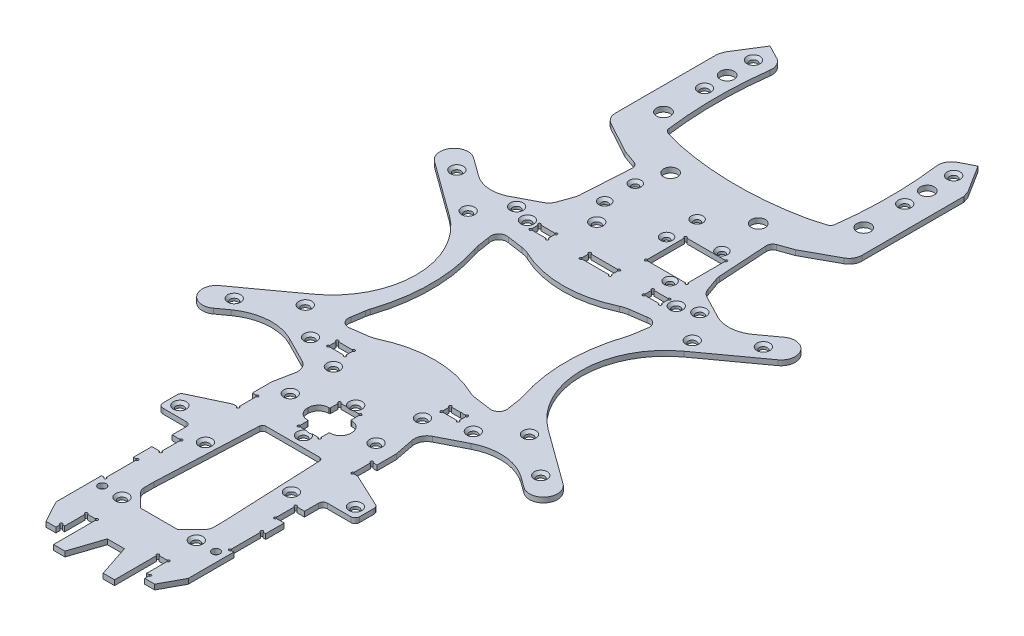
from build123d import *

# Parameters (mm, degrees)
SKETCH_1_R               = 1.075
SKETCH_1_R_2             = 1.55
SKETCH_1_R_3             = 3.15
SKETCH_1_R_4             = 1.3
SKETCH_1_R_5             = 2.75
SKETCH_1_R_6             = 3.150000003
SKETCH_1_W               = 8.2
SKETCH_1_H               = 15.5
EXTRUDE_1_DEPTH          = 2
CUT_EXTRUDE_8318_REACH   = 179.316
CUT_EXTRUDE_2_DEPTH      = 178.315547956
CUT_EXTRUDE_2_DEPTH_BACK = 178.315547956
FILLET_1_R               = 5
CUT_EXTRUDE_10782_REACH  = 179.316
SKETCH_7_W               = 6.5
SKETCH_7_H               = 3.5
SKETCH_7_W_2             = 11.5
SKETCH_8_W               = 7.75
SKETCH_8_H               = 15.5
SKETCH_8_R               = 1.55
PCB_DEPTH                = 178.315547956
FILLET_2_R               = 1.75
SKETCH_12_R              = 1.55
CUT_EXTRUDE_12404_DEPTH  = 178.315547956
CHAMFER_13500_SIZE       = 1
CUT_EXTRUDE_14527_DEPTH  = 178.315547956
SKETCH_14808_R           = 0.5
CUT_EXTRUDE_16013_DEPTH  = 178.315547956


with BuildPart() as part:
    # 草图1 → 凸台-拉伸1 (new body)
    with BuildSketch(Plane(origin=(0, 0, 0), x_dir=(1, 0, 0), z_dir=(0, 1, 0))):
        with BuildLine():
            Line((30.471931762, 81.490896857), (48.416521639, 91.317818223))
            Line((48.416521639, 91.317818223), (48.416521639, 134.322222668))
            Line((48.416521639, 134.322222668), (47.651247851, 136.689513364))
            Line((47.651247851, 136.689513364), (40.869501648, 147.464808499))
            Line((40.869501648, 147.464808499), (35.510663468, 144.702808272))
            ThreePointArc((35.510663468, 144.702808272), (33.242094057, 142.452145099), (32.67537009, 139.307194251))
            ThreePointArc((32.67537009, 139.307194251), (33.937004878, 119.372552101), (32.641885169, 99.440057402))
            ThreePointArc((32.641885169, 99.440057402), (32.172065597, 98.389885069), (31.201404983, 97.7723008))
            Line((31.201404983, 97.7723008), (25.278020284, 96.101602551))
            ThreePointArc((25.278020284, 96.101602551), (0, 93.449866343), (-25.278020284, 96.101602551))
            Line((-25.278020284, 96.101602551), (-31.201404983, 97.7723008))
            ThreePointArc((-31.201404983, 97.7723008), (-32.172065597, 98.389885069), (-32.641885169, 99.440057402))
            ThreePointArc((-32.641885169, 99.440057402), (-33.937004878, 119.372552101), (-32.67537009, 139.307194251))
            ThreePointArc((-32.67537009, 139.307194251), (-33.242094057, 142.452145099), (-35.510663468, 144.702808272))
            Line((-35.510663468, 144.702808272), (-40.869501648, 147.464808499))
            Line((-40.869501648, 147.464808499), (-47.651247851, 136.689513364))
            Line((-47.651247851, 136.689513364), (-48.416521639, 134.322222668))
            Line((-48.416521639, 134.322222668), (-48.416521639, 91.317818223))
            Line((-48.416521639, 91.317818223), (-30.471931762, 81.490896857))
            Line((-30.471931762, 81.490896857), (-34.379381927, 54.281455672))
            ThreePointArc((-34.379381927, 54.281455672), (-41.833088467, 44.612792097), (-53.961797186, 46.00391442))
            Line((-53.961797186, 46.00391442), (-61.036827427, 51.144224776))
            ThreePointArc((-61.036827427, 51.144224776), (-68.719239783, 49.927450195), (-67.502465202, 42.245037838))
            Line((-67.502465202, 42.245037838), (-46.1030207, 26.697431331))
            ThreePointArc((-46.1030207, 26.697431331), (-32.5, 0), (-46.1030207, -26.697431331))
            Line((-46.1030207, -26.697431331), (-67.502465202, -42.245037838))
            ThreePointArc((-67.502465202, -42.245037838), (-68.719239783, -49.927450195), (-61.036827427, -51.144224776))
            Line((-61.036827427, -51.144224776), (-57.019972942, -48.225809165))
            ThreePointArc((-57.019972942, -48.225809165), (-35.683007368, -46.546553555), (-24.5, -64.795562996))
            Line((-24.5, -64.795562996), (-24.5, -72.371672247))
            Line((-24.5, -72.371672247), (-22.5, -72.371672247))
            Line((-22.5, -72.371672247), (-22.5, -79.947781498))
            Line((-22.5, -79.947781498), (-24.5, -79.947781498))
            Line((-24.5, -79.947781498), (-38.680376069, -86.6))
            Line((-38.680376069, -86.6), (-38.680376069, -95.1))
            Line((-38.680376069, -95.1), (-26.001126091, -95.1))
            Line((-26.001126091, -95.1), (-26.001126091, -102.35))
            Line((-26.001126091, -102.35), (-22.5, -102.35))
            Line((-22.5, -102.35), (-22.5, -110.35))
            Line((-22.5, -110.35), (-26.001126091, -110.35))
            Line((-26.001126091, -110.35), (-26.001126091, -117.6))
            Line((-26.001126091, -117.6), (-24.501126091, -117.6))
            Line((-24.501126091, -117.6), (-24.501126091, -130.1))
            Line((-24.501126091, -130.1), (-26.001126091, -130.1))
            Line((-26.001126091, -130.1), (-26.001126091, -148.0463267))
            Line((-26.001126091, -148.0463267), (-21.353443149, -156.6))
            Line((-21.353443149, -156.6), (-17.45, -156.6))
            Line((-17.45, -156.6), (-17.45, -154.5))
            Line((-17.45, -154.5), (-16.1, -154.5))
            Line((-16.1, -154.5), (-16.1, -146))
            Line((-16.1, -146), (-12, -146))
            Line((-12, -146), (-12, -163))
            Line((-12, -163), (-7.5, -163))
            Line((-7.5, -163), (-3.358391833, -150.5))
            Line((-3.358391833, -150.5), (3.358391833, -150.5))
            Line((3.358391833, -150.5), (7.5, -163))
            Line((7.5, -163), (12, -163))
            Line((12, -163), (12, -146))
            Line((12, -146), (16.1, -146))
            Line((16.1, -146), (16.1, -154.5))
            Line((16.1, -154.5), (17.45, -154.5))
            Line((17.45, -154.5), (17.45, -156.6))
            Line((17.45, -156.6), (21.353443149, -156.6))
            Line((21.353443149, -156.6), (26.001126091, -148.0463267))
            Line((26.001126091, -148.0463267), (26.001126091, -130.1))
            Line((26.001126091, -130.1), (24.501126091, -130.1))
            Line((24.501126091, -130.1), (24.501126091, -117.6))
            Line((24.501126091, -117.6), (26.001126091, -117.6))
            Line((26.001126091, -117.6), (26.001126091, -110.35))
            Line((26.001126091, -110.35), (22.5, -110.35))
            Line((22.5, -110.35), (22.5, -102.35))
            Line((22.5, -102.35), (26.001126091, -102.35))
            Line((26.001126091, -102.35), (26.001126091, -95.1))
            Line((26.001126091, -95.1), (38.680376069, -95.1))
            Line((38.680376069, -95.1), (38.680376069, -86.6))
            Line((38.680376069, -86.6), (24.5, -79.947781498))
            Line((24.5, -79.947781498), (22.5, -79.947781498))
            Line((22.5, -79.947781498), (22.5, -72.371672247))
            Line((22.5, -72.371672247), (24.5, -72.371672247))
            Line((24.5, -72.371672247), (24.5, -64.795562996))
            ThreePointArc((24.5, -64.795562996), (35.683007368, -46.546553555), (57.019972942, -48.225809165))
            Line((57.019972942, -48.225809165), (61.036827427, -51.144224776))
            ThreePointArc((61.036827427, -51.144224776), (68.719239784, -49.927450195), (67.502465202, -42.245037838))
            Line((67.502465202, -42.245037838), (46.1030207, -26.697431331))
            ThreePointArc((46.1030207, -26.697431331), (32.5, 0), (46.1030207, 26.697431331))
            Line((46.1030207, 26.697431331), (67.502465202, 42.245037838))
            ThreePointArc((67.502465202, 42.245037838), (68.719239784, 49.927450195), (61.036827427, 51.144224776))
            Line((61.036827427, 51.144224776), (53.961797187, 46.00391442))
            ThreePointArc((53.961797187, 46.00391442), (41.833088467, 44.612792097), (34.379381927, 54.281455672))
            Line((34.379381927, 54.281455672), (30.471931762, 81.490896857))
        make_face()
        with Locations(Location((10, 10, 0), (0, 0, 270))):
            Circle(SKETCH_1_R, mode=Mode.SUBTRACT)
        with Locations(Location((12.75, 12.75, 0), (0, 0, 270))):
            Circle(SKETCH_1_R, mode=Mode.SUBTRACT)
        with Locations(Location((15.25, 15.25, 0), (0, 0, 270))):
            Circle(SKETCH_1_R_2, mode=Mode.SUBTRACT)
        with Locations(Location((-15.25, 15.25, 0), (0, 0, 90))):
            Circle(SKETCH_1_R_2, mode=Mode.SUBTRACT)
        with Locations(Location((-12.75, 12.75, 0), (0, 0, 90))):
            Circle(SKETCH_1_R, mode=Mode.SUBTRACT)
        with Locations(Location((-10, 10, 0), (0, 0, 90))):
            Circle(SKETCH_1_R, mode=Mode.SUBTRACT)
        with Locations(Location((-10, -10, 0), (0, 0, 270))):
            Circle(SKETCH_1_R, mode=Mode.SUBTRACT)
        with Locations(Location((-12.75, -12.75, 0), (0, 0, 270))):
            Circle(SKETCH_1_R, mode=Mode.SUBTRACT)
        with Locations(Location((-15.25, -15.25, 0), (0, 0, 270))):
            Circle(SKETCH_1_R_2, mode=Mode.SUBTRACT)
        with Locations(Location((15.25, -15.25, 0), (0, 0, 90))):
            Circle(SKETCH_1_R_2, mode=Mode.SUBTRACT)
        with Locations(Location((12.75, -12.75, 0), (0, 0, 90))):
            Circle(SKETCH_1_R, mode=Mode.SUBTRACT)
        with Locations(Location((10, -10, 0), (0, 0, 90))):
            Circle(SKETCH_1_R, mode=Mode.SUBTRACT)
        with Locations(Location((28, -28, 0), (0, 0, 90))):
            Circle(SKETCH_1_R_3, mode=Mode.SUBTRACT)
        with Locations(Location((-28, -28, 0), (0, 0, 270))):
            Circle(SKETCH_1_R_3, mode=Mode.SUBTRACT)
        with Locations(Location((19.5, 68.199999999, 0), (0, 0, 90))):
            Circle(SKETCH_1_R_4, mode=Mode.SUBTRACT)
        with Locations(Location((19.5, 47.800000001, 0), (0, 0, 90))):
            Circle(SKETCH_1_R_4, mode=Mode.SUBTRACT)
        with Locations(Location((17.23796389, 84.763336754, 0), (0, 0, 270))):
            Circle(SKETCH_1_R_5, mode=Mode.SUBTRACT)
        with Locations(Location((-17.23796389, 84.763336754, 0), (0, 0, 90))):
            Circle(SKETCH_1_R_5, mode=Mode.SUBTRACT)
        with Locations(Location((-39.335, 104.082300402, 0), (0, 0, 90))):
            Circle(SKETCH_1_R_5, mode=Mode.SUBTRACT)
        with Locations(Location((-39.335, 129.082300402, 0), (0, 0, 90))):
            Circle(SKETCH_1_R_5, mode=Mode.SUBTRACT)
        with Locations(Location((-28, 28, 0), (0, 0, 90))):
            Circle(SKETCH_1_R_6, mode=Mode.SUBTRACT)
        with Locations(Location((28, 28, 0), (0, 0, 270))):
            Circle(SKETCH_1_R_6, mode=Mode.SUBTRACT)
        with Locations(Location((44.044221455, -32, 0), (0, 0, 270))):
            Circle(SKETCH_1_R_2, mode=Mode.SUBTRACT)
        with Locations(Location((60.224561343, -43.755705046, 0), (0, 0, 270))):
            Circle(SKETCH_1_R_2, mode=Mode.SUBTRACT)
        with Locations(Location((-60.224561343, -43.755705046, 0), (0, 0, 90))):
            Circle(SKETCH_1_R_2, mode=Mode.SUBTRACT)
        with Locations(Location((-20.5, 74.15002051, 0), (0, 0, 270))):
            Circle(SKETCH_1_R_4, mode=Mode.SUBTRACT)
        with Locations(Location((-20.5, 62.12002051, 0), (0, 0, 90))):
            Circle(SKETCH_1_R_4, mode=Mode.SUBTRACT)
        with Locations(Location((-44.044221455, -32, 0), (0, 0, 90))):
            Circle(SKETCH_1_R_2, mode=Mode.SUBTRACT)
        with Locations(Location((60.224561343, 43.755705046, 0), (0, 0, 90))):
            Circle(SKETCH_1_R_2, mode=Mode.SUBTRACT)
        with Locations(Location((44.044221455, 32, 0), (0, 0, 90))):
            Circle(SKETCH_1_R_2, mode=Mode.SUBTRACT)
        with Locations(Location((-44.044221455, 32, 0), (0, 0, 270))):
            Circle(SKETCH_1_R_2, mode=Mode.SUBTRACT)
        with Locations(Location((-60.224561343, 43.755705046, 0), (0, 0, 270))):
            Circle(SKETCH_1_R_2, mode=Mode.SUBTRACT)
        with Locations(Location((-22.35, -133.5, 0), (0, 0, 90))):
            Circle(SKETCH_1_R_2, mode=Mode.SUBTRACT)
        with Locations(Location((22.35, -133.5, 0), (0, 0, 270))):
            Circle(SKETCH_1_R_2, mode=Mode.SUBTRACT)
        with Locations(Location((-16.9, -98.4, 0), (0, 0, 270))):
            Circle(SKETCH_1_R_2, mode=Mode.SUBTRACT)
        with Locations(Location((16.9, -98.4, 0), (0, 0, 90))):
            Circle(SKETCH_1_R_2, mode=Mode.SUBTRACT)
        with Locations(Location((-14.6, -133.5, 0), (0, 0, 90))):
            Circle(SKETCH_1_R_2, mode=Mode.SUBTRACT)
        with Locations(Location((14.6, -133.5, 0), (0, 0, 270))):
            Circle(SKETCH_1_R_2, mode=Mode.SUBTRACT)
        with Locations(Location((-16.865979253, -65.108043073, 0), (0, 0, 270))):
            Circle(SKETCH_1_R_2, mode=Mode.SUBTRACT)
        with Locations(Location((16.865979253, -65.108043073, 0), (0, 0, 90))):
            Circle(SKETCH_1_R_2, mode=Mode.SUBTRACT)
        with Locations(Location((0, -56.25, 0), (0, 0, 270))):
            Circle(SKETCH_1_R_2, mode=Mode.SUBTRACT)
        with Locations(Location((0, -76.75, 0), (0, 0, 270))):
            Circle(SKETCH_1_R_2, mode=Mode.SUBTRACT)
        with Locations(Location((39.335, 129.082300402, 0), (0, 0, 270))):
            Circle(SKETCH_1_R_5, mode=Mode.SUBTRACT)
        with Locations(Location((39.335, 104.082300402, 0), (0, 0, 270))):
            Circle(SKETCH_1_R_5, mode=Mode.SUBTRACT)
        with Locations(Location((-36, 43, 0), (0, 0, 270))):
            Circle(SKETCH_1_R_2, mode=Mode.SUBTRACT)
        with Locations(Location((36, 43, 0), (0, 0, 90))):
            Circle(SKETCH_1_R_2, mode=Mode.SUBTRACT)
        with Locations(Location((-32, -42, 0), (0, 0, 270))):
            Circle(SKETCH_1_R_2, mode=Mode.SUBTRACT)
        with Locations(Location((32, -42, 0), (0, 0, 90))):
            Circle(SKETCH_1_R_2, mode=Mode.SUBTRACT)
        with Locations(Location((-39.335, 139.432300402, 0), (0, 0, 270))):
            Circle(SKETCH_1_R_2, mode=Mode.SUBTRACT)
        with Locations(Location((39.335, 139.432300402, 0), (0, 0, 270))):
            Circle(SKETCH_1_R_2, mode=Mode.SUBTRACT)
        with Locations(Location((34.5, -90.85, 0), (0, 0, 270))):
            Circle(SKETCH_1_R_2, mode=Mode.SUBTRACT)
        with Locations(Location((-34.5, -90.85, 0), (0, 0, 90))):
            Circle(SKETCH_1_R_2, mode=Mode.SUBTRACT)
        with Locations(Location((39.335, 120.182300402, 0), (0, 0, 270))):
            Circle(SKETCH_1_R_2, mode=Mode.SUBTRACT)
        with Locations(Location((-39.335, 120.182300402, 0), (0, 0, 90))):
            Circle(SKETCH_1_R_2, mode=Mode.SUBTRACT)
        with Locations(Location((3.8, 62.12002051, 0), (0, 0, 270))):
            Circle(SKETCH_1_R_4, mode=Mode.SUBTRACT)
        with Locations(Location((3.8, 74.15002051, 0), (0, 0, 90))):
            Circle(SKETCH_1_R_4, mode=Mode.SUBTRACT)
        with Locations((19.5, 58)):
            Rectangle(SKETCH_1_W, SKETCH_1_H, mode=Mode.SUBTRACT)
        with BuildLine():
            Line((4.100927376, -74), (4.100927376, -71.047482953))
            ThreePointArc((4.100927376, -71.047482953), (4.203440002, -70.79999558), (4.450927376, -70.697482953))
            Line((4.450927376, -70.697482953), (4.548421614, -70.697482953))
            ThreePointArc((4.548421614, -70.697482953), (7.376848739, -69.525910078), (8.548421615, -66.697482953))
            Line((8.548421615, -66.697482953), (8.548421615, -66.302516462))
            ThreePointArc((8.548421615, -66.302516462), (7.37684874, -63.474089336), (4.548421613, -62.302516461))
            Line((4.548421613, -62.302516461), (4.450927376, -62.302516461))
            ThreePointArc((4.450927376, -62.302516461), (4.203440002, -62.200003834), (4.100927376, -61.952516461))
            Line((4.100927376, -61.952516461), (4.100927376, -59))
            ThreePointArc((4.100927376, -59), (4.454480766, -58.146446609), (3.600927376, -58.5))
            Line((3.600927376, -58.5), (-3.599072624, -58.5))
            ThreePointArc((-3.599072624, -58.5), (-4.451306171, -58.143276898), (-4.100927376, -58.998138343))
            Line((-4.100927376, -58.998138343), (-4.100927376, -61.951116293))
            ThreePointArc((-4.100927376, -61.951116293), (-4.203440002, -62.198603667), (-4.450927376, -62.301116293))
            Line((-4.450927376, -62.301116293), (-4.54842161, -62.301116293))
            ThreePointArc((-4.54842161, -62.301116293), (-7.376848734, -63.472689168), (-8.54842161, -66.301116291))
            Line((-8.54842161, -66.301116291), (-8.54842161, -66.696082786))
            ThreePointArc((-8.54842161, -66.696082786), (-7.376848735, -69.52450991), (-4.548421612, -70.696082786))
            Line((-4.548421612, -70.696082786), (-4.450927376, -70.696082786))
            ThreePointArc((-4.450927376, -70.696082786), (-4.203440002, -70.798595412), (-4.100927376, -71.046082786))
            Line((-4.100927376, -71.046082786), (-4.100927376, -74))
            ThreePointArc((-4.100927376, -74), (-4.454480766, -74.853553391), (-3.600927376, -74.5))
            Line((-3.600927376, -74.5), (3.600927376, -74.5))
            ThreePointArc((3.600927376, -74.5), (4.454480766, -74.853553391), (4.100927376, -74))
        make_face(mode=Mode.SUBTRACT)
        with BuildLine():
            Line((-13.576089496, -121.85459027), (-11.848710623, -82.291109542))
            ThreePointArc((-11.848710623, -82.291109542), (-11.433539527, -81.374807407), (-10.5, -81))
            Line((-10.5, -81), (10.5, -81))
            ThreePointArc((10.5, -81), (11.433539527, -81.374807407), (11.848710623, -82.291109542))
            Line((11.848710623, -82.291109542), (13.576089496, -121.85459027))
            ThreePointArc((13.576089496, -121.85459027), (13.578498589, -121.928180466), (13.579301748, -122.001805703))
            Line((13.579301748, -122.001805703), (13.579301748, -125.768411616))
            ThreePointArc((13.579301748, -125.768411616), (13.322655903, -127.059338556), (12.591750717, -128.153933031))
            Line((12.591750717, -128.153933031), (7.25, -133.5))
            Line((7.25, -133.5), (-7.25, -133.5))
            Line((-7.25, -133.5), (-12.591750717, -128.153933031))
            ThreePointArc((-12.591750717, -128.153933031), (-13.322655903, -127.059338556), (-13.579301748, -125.768411616))
            Line((-13.579301748, -125.768411616), (-13.579301748, -122.001805703))
            ThreePointArc((-13.579301748, -122.001805703), (-13.578498589, -121.928180466), (-13.576089496, -121.85459027))
        make_face(mode=Mode.SUBTRACT)
    extrude(amount=EXTRUDE_1_DEPTH)

    # 草图6 → Cut-Extrude 8318 (cut, up to next)
    with BuildSketch(Plane(origin=(0, 2, 0), x_dir=(1, 0, 0), z_dir=(0, 1, 0)), mode=Mode.PRIVATE) as cut_extrude_8318_sk1:
        with BuildLine():
            Line((22.585858829, -13.811806674), (4.369879231, 0))
            Line((4.369879231, 0), (22.585858829, 13.811806674))
            ThreePointArc((22.585858829, 13.811806674), (25.637017076, 15.667901474), (28.86482634, 17.196267238))
            ThreePointArc((28.86482634, 17.196267238), (26.560773664, 0), (28.86482634, -17.196267238))
            ThreePointArc((28.86482634, -17.196267238), (25.637017076, -15.667901474), (22.585858829, -13.811806674))
        make_face()
    cut_extrude_8318_tool1 = extrude(cut_extrude_8318_sk1.sketch, amount=-CUT_EXTRUDE_8318_REACH, mode=Mode.PRIVATE) & part.part
    # 草图6 → Cut-Extrude 8318 (cut, up to next)
    with BuildSketch(Plane(origin=(0, 2, 0), x_dir=(1, 0, 0), z_dir=(0, 1, 0)), mode=Mode.PRIVATE) as cut_extrude_8318_sk2:
        with BuildLine():
            Line((-22.585858829, 13.811806674), (-4.369879231, 0))
            Line((-4.369879231, 0), (-22.585858829, -13.811806674))
            ThreePointArc((-22.585858829, -13.811806674), (-25.637017076, -15.667901474), (-28.86482634, -17.196267238))
            ThreePointArc((-28.86482634, -17.196267238), (-26.560773664, 0), (-28.86482634, 17.196267238))
            ThreePointArc((-28.86482634, 17.196267238), (-25.637017076, 15.667901474), (-22.585858829, 13.811806674))
        make_face()
    cut_extrude_8318_tool2 = extrude(cut_extrude_8318_sk2.sketch, amount=-CUT_EXTRUDE_8318_REACH, mode=Mode.PRIVATE) & part.part
    # 草图6 → Cut-Extrude 8318 (cut, up to next)
    with BuildSketch(Plane(origin=(0, 2, 0), x_dir=(1, 0, 0), z_dir=(0, 1, 0)), mode=Mode.PRIVATE) as cut_extrude_8318_sk3:
        with BuildLine():
            Line((-11.538849406, -19.588123327), (0, -4.369879231))
            Line((0, -4.369879231), (11.538849406, -19.588123327))
            ThreePointArc((11.538849406, -19.588123327), (12.705885919, -21.223769084), (13.776098615, -22.924344296))
            ThreePointArc((13.776098615, -22.924344296), (0, -21.563956437), (-13.776098615, -22.924344296))
            ThreePointArc((-13.776098615, -22.924344296), (-12.705885919, -21.223769084), (-11.538849406, -19.588123327))
        make_face()
    cut_extrude_8318_tool3 = extrude(cut_extrude_8318_sk3.sketch, amount=-CUT_EXTRUDE_8318_REACH, mode=Mode.PRIVATE) & part.part
    # 草图6 → Cut-Extrude 8318 (cut, up to next)
    with BuildSketch(Plane(origin=(0, 2, 0), x_dir=(1, 0, 0), z_dir=(0, 1, 0)), mode=Mode.PRIVATE) as cut_extrude_8318_sk4:
        with BuildLine():
            Line((11.538849406, 19.588123327), (0, 4.369879231))
            Line((0, 4.369879231), (-11.538849406, 19.588123327))
            ThreePointArc((-11.538849406, 19.588123327), (-12.705885919, 21.223769084), (-13.776098615, 22.924344296))
            ThreePointArc((-13.776098615, 22.924344296), (0, 21.563956437), (13.776098615, 22.924344296))
            ThreePointArc((13.776098615, 22.924344296), (12.705885919, 21.223769084), (11.538849406, 19.588123327))
        make_face()
    cut_extrude_8318_tool4 = extrude(cut_extrude_8318_sk4.sketch, amount=-CUT_EXTRUDE_8318_REACH, mode=Mode.PRIVATE) & part.part
    add(cut_extrude_8318_tool1.solids().sort_by_distance((19.61748, 2, 0))[0], mode=Mode.SUBTRACT)
    add(cut_extrude_8318_tool2.solids().sort_by_distance((-19.61748, 2, 0))[0], mode=Mode.SUBTRACT)
    add(cut_extrude_8318_tool3.solids().sort_by_distance((0, 2, 16.124427))[0], mode=Mode.SUBTRACT)
    add(cut_extrude_8318_tool4.solids().sort_by_distance((0, 2, -16.124427))[0], mode=Mode.SUBTRACT)

    # 减重-2-草图 → 切除-拉伸2 (cut, two sides: drawn at the far end of the back side and taken through both)
    with BuildSketch(Plane(origin=(0, 0, 0), x_dir=(1, 0, 0), z_dir=(0, 1, 0)).offset(-CUT_EXTRUDE_2_DEPTH_BACK)):
        with BuildLine():
            Line((-20.984532875, 30.182751164), (-28, 31.150000003))
            ThreePointArc((-28, 31.150000003), (-30.227386363, 30.227386363), (-31.150000003, 28))
            Line((-31.150000003, 28), (-30.249837749, 22.121798077))
            ThreePointArc((-30.249837749, 22.121798077), (-30.088892658, 21.3015792), (-29.860010865, 20.497666609))
            ThreePointArc((-29.860010865, 20.497666609), (-26.560773664, 0), (-29.860010865, -20.497666609))
            ThreePointArc((-29.860010865, -20.497666609), (-30.088892658, -21.3015792), (-30.249837749, -22.121798077))
            Line((-30.249837749, -22.121798077), (-31.150000003, -28))
            ThreePointArc((-31.150000003, -28), (-30.227386363, -30.227386363), (-28, -31.150000003))
            Line((-28, -31.150000003), (-20.984532875, -30.182751164))
            ThreePointArc((-20.984532875, -30.182751164), (-19.488215601, -29.858121938), (-18.058996763, -29.30886514))
            ThreePointArc((-18.058996763, -29.30886514), (0, -25.236991536), (18.058996763, -29.30886514))
            ThreePointArc((18.058996763, -29.30886514), (19.488215601, -29.858121938), (20.984532875, -30.182751164))
            Line((20.984532875, -30.182751164), (28, -31.150000003))
            ThreePointArc((28, -31.150000003), (30.227386363, -30.227386363), (31.150000003, -28))
            Line((31.150000003, -28), (30.249837749, -22.121798077))
            ThreePointArc((30.249837749, -22.121798077), (30.088892658, -21.3015792), (29.860010865, -20.497666609))
            ThreePointArc((29.860010865, -20.497666609), (26.560773664, 0), (29.860010865, 20.497666609))
            ThreePointArc((29.860010865, 20.497666609), (30.088892658, 21.3015792), (30.249837749, 22.121798077))
            Line((30.249837749, 22.121798077), (31.150000003, 28))
            ThreePointArc((31.150000003, 28), (30.227386363, 30.227386363), (28, 31.150000003))
            Line((28, 31.150000003), (20.984532875, 30.182751164))
            ThreePointArc((20.984532875, 30.182751164), (19.488215601, 29.858121938), (18.058996763, 29.30886514))
            ThreePointArc((18.058996763, 29.30886514), (0, 25.236991536), (-18.058996763, 29.30886514))
            ThreePointArc((-18.058996763, 29.30886514), (-19.488215601, 29.858121938), (-20.984532875, 30.182751164))
        make_face()
    extrude(amount=CUT_EXTRUDE_2_DEPTH + CUT_EXTRUDE_2_DEPTH_BACK, mode=Mode.SUBTRACT)

    # 圆角1
    # the kernel refuses this fillet: 5 mm, written as the material it adds along each edge
    with BuildSketch(Plane(origin=(25.278020284, 0, -96.101602551), x_dir=(-0.97837491387316, 0, 0.2068393770627025), z_dir=(0, 1, 0))) as fillet_1_piece_1:
        with BuildLine():
            CenterArc((0.166495919, -4.999998783), FILLET_1_R, 89.960021775, 3.853956222)
            Line((-0.166090701, -0.011072431), (0, 0))
            ThreePointArc((0, 0), (0.084992339, 2.9652e-05), (0.169984677, 0))
        make_face()
    extrude(amount=2)
    with BuildSketch(Plane(origin=(30.471931762, 0, -81.490896857), x_dir=(0.8770937526435779, 0, -0.4803192158071609), z_dir=(0, 1, 0)), Plane(origin=(-30.471931762, 0, -81.490896857), x_dir=(-0.1421481435294535, 0, 0.9898453946405619), z_dir=(0, 1, 0))) as fillet_1_piece_2:
        with BuildLine():
            CenterArc((FILLET_1_R * 0.693284200238, -FILLET_1_R), FILLET_1_R, 90, 69.465916604)
            Line((-FILLET_1_R * 0.243179496312, -FILLET_1_R * 0.649235484915), (0, 0))
            Line((0, 0), (FILLET_1_R * 0.693284200238, 0))
        make_face()
    extrude(amount=2)
    with BuildSketch(Plane(origin=(-25.278020284, 0, -96.101602551), x_dir=(-0.9624496759863836, 0, -0.2714601650218782), z_dir=(0, 1, 0))) as fillet_1_piece_3:
        with BuildLine():
            CenterArc((0.166459364, -5), FILLET_1_R, 90, 3.853956222)
            ThreePointArc((-0.169608207, -0.011306926), (-0.084806076, -0.005623877), (0, 0))
            Line((0, 0), (0.166459364, 0))
        make_face()
    extrude(amount=2)
    # the kernel refuses this fillet: 5 mm, written as the material it takes off along each edge
    with BuildSketch(Plane(origin=(48.416521639, -7.406288989, -91.317818223), x_dir=(-0.877093752643578, 0, 0.48031921580716064), z_dir=(0, 1, 0)), Plane(origin=(-48.416521639, -7.406288989, -91.317818223), x_dir=(0, 0, -1), z_dir=(0, 1, 0))) as fillet_1_2_piece_1:
        with BuildLine():
            CenterArc((FILLET_1_R * 0.59250311911, -FILLET_1_R), FILLET_1_R, 90, 61.293747425)
            Line((-FILLET_1_R * 0.284590633534, -FILLET_1_R * 0.519680784193), (0, 0))
            Line((0, 0), (FILLET_1_R * 0.59250311911, 0))
        make_face()
    extrude(amount=16.812577978, mode=Mode.SUBTRACT)

    # 草图7 → Cut-Extrude 10782 (cut, up to next)
    with BuildSketch(Plane(origin=(0, 2, 0), x_dir=(1, 0, 0), z_dir=(0, 1, 0)), mode=Mode.PRIVATE) as cut_extrude_10782_sk1:
        with Locations((22.25, -39.75)):
            Rectangle(SKETCH_7_W, SKETCH_7_H)
    cut_extrude_10782_tool1 = extrude(cut_extrude_10782_sk1.sketch, amount=-CUT_EXTRUDE_10782_REACH, mode=Mode.PRIVATE) & part.part
    # 草图7 → Cut-Extrude 10782 (cut, up to next)
    with BuildSketch(Plane(origin=(0, 2, 0), x_dir=(1, 0, 0), z_dir=(0, 1, 0)), mode=Mode.PRIVATE) as cut_extrude_10782_sk2:
        with Locations((-22.25, 39.75)):
            Rectangle(SKETCH_7_W, SKETCH_7_H)
    cut_extrude_10782_tool2 = extrude(cut_extrude_10782_sk2.sketch, amount=-CUT_EXTRUDE_10782_REACH, mode=Mode.PRIVATE) & part.part
    # 草图7 → Cut-Extrude 10782 (cut, up to next)
    with BuildSketch(Plane(origin=(0, 2, 0), x_dir=(1, 0, 0), z_dir=(0, 1, 0)), mode=Mode.PRIVATE) as cut_extrude_10782_sk3:
        with Locations((-22.25, -39.75)):
            Rectangle(SKETCH_7_W, SKETCH_7_H)
    cut_extrude_10782_tool3 = extrude(cut_extrude_10782_sk3.sketch, amount=-CUT_EXTRUDE_10782_REACH, mode=Mode.PRIVATE) & part.part
    # 草图7 → Cut-Extrude 10782 (cut, up to next)
    with BuildSketch(Plane(origin=(0, 2, 0), x_dir=(1, 0, 0), z_dir=(0, 1, 0)), mode=Mode.PRIVATE) as cut_extrude_10782_sk4:
        with Locations((22.25, 39.75)):
            Rectangle(SKETCH_7_W, SKETCH_7_H)
    cut_extrude_10782_tool4 = extrude(cut_extrude_10782_sk4.sketch, amount=-CUT_EXTRUDE_10782_REACH, mode=Mode.PRIVATE) & part.part
    # 草图7 → Cut-Extrude 10782 (cut, up to next)
    with BuildSketch(Plane(origin=(0, 2, 0), x_dir=(1, 0, 0), z_dir=(0, 1, 0)), mode=Mode.PRIVATE) as cut_extrude_10782_sk5:
        with Locations((0, 39.75)):
            Rectangle(SKETCH_7_W_2, SKETCH_7_H)
    cut_extrude_10782_tool5 = extrude(cut_extrude_10782_sk5.sketch, amount=-CUT_EXTRUDE_10782_REACH, mode=Mode.PRIVATE) & part.part
    add(cut_extrude_10782_tool1.solids().sort_by_distance((22.25, 2, 39.75))[0], mode=Mode.SUBTRACT)
    add(cut_extrude_10782_tool2.solids().sort_by_distance((-22.25, 2, -39.75))[0], mode=Mode.SUBTRACT)
    add(cut_extrude_10782_tool3.solids().sort_by_distance((-22.25, 2, 39.75))[0], mode=Mode.SUBTRACT)
    add(cut_extrude_10782_tool4.solids().sort_by_distance((22.25, 2, -39.75))[0], mode=Mode.SUBTRACT)
    add(cut_extrude_10782_tool5.solids().sort_by_distance((0, 2, -39.75))[0], mode=Mode.SUBTRACT)

    # 草图8 → 计算机板接口和分电PCB接口 (cut, through all)
    with BuildSketch(Plane(origin=(0, 0, 0), x_dir=(1, 0, 0), z_dir=(0, 1, 0))):
        with Locations((11.525, 58)):
            Rectangle(SKETCH_8_W, SKETCH_8_H)
        with Locations(Location((-29.25, 40.5, 0), (0, 0, 270))):
            Circle(SKETCH_8_R)
        with Locations(Location((-17.5, -47.5, 0), (0, 0, 270))):
            Circle(SKETCH_8_R)
        with Locations(Location((17.5, -47.5, 0), (0, 0, 270))):
            Circle(SKETCH_8_R)
        with Locations(Location((29.25, 40.5, 0), (0, 0, 270))):
            Circle(SKETCH_8_R)
        with Locations((23.5, -39.46275604)):
            Circle(SKETCH_8_R)
    extrude(amount=PCB_DEPTH, mode=Mode.SUBTRACT)

    # 圆角2
    fillet_2_edges = [part.edges().sort_by_distance(p)[0] for p in [
        (24.5, 1, 79.947781498),
        (38.680376069, 1, 86.6),
        (38.680376069, 1, 95.1),
        (26.001126091, 1, 95.1),
        (-26.001126091, 1, 95.1),
        (-38.680376069, 1, 95.1),
        (-38.680376069, 1, 86.6),
        (-24.5, 1, 79.947781498),
    ]]
    fillet(fillet_2_edges, radius=FILLET_2_R)

    # 草图12 → Cut-Extrude 12404 (cut, through all)
    with BuildSketch(Plane(origin=(0, 0, 0), x_dir=(1, 0, 0), z_dir=(0, 1, 0))):
        with Locations(Location((-15, 53.5, 0), (0, 0, 270))):
            Circle(SKETCH_12_R)
    extrude(amount=CUT_EXTRUDE_12404_DEPTH, mode=Mode.SUBTRACT)

    # Chamfer 13500
    # the kernel refuses this chamfer: 1 mm, written as the material it takes off along each edge
    with BuildSketch(Plane(origin=(-15, 2, -53.5), x_dir=(0, 0, 1), z_dir=(1, 0, 0))) as chamfer_13500_piece_1:
        Polygon((1.55 + CHAMFER_13500_SIZE, 0), (1.55, CHAMFER_13500_SIZE), (1.55, 0), align=None)
    chamfer_13500_piece_1_solid = revolve(axis=Axis((-15, 2, -53.5), (0, -1, 0)), mode=Mode.PRIVATE)
    with BuildSketch(Plane(origin=(-32, 2, 42), x_dir=(0, 0, 1), z_dir=(-1, 0, 0))) as chamfer_13500_piece_2:
        Polygon((1.55 + CHAMFER_13500_SIZE, 0), (1.55, -CHAMFER_13500_SIZE), (1.55, 0), align=None)
    chamfer_13500_piece_2_solid = revolve(axis=Axis((-32, 2, 42), (0, 1, 0)), mode=Mode.PRIVATE)
    with BuildSketch(Plane(origin=(44.044221455, 2, 32), x_dir=(0, 0, 1), z_dir=(-1, 0, 0))) as chamfer_13500_piece_3:
        Polygon((1.55 + CHAMFER_13500_SIZE, 0), (1.55, -CHAMFER_13500_SIZE), (1.55, 0), align=None)
    chamfer_13500_piece_3_solid = revolve(axis=Axis((44.044221455, 2, 32), (0, 1, 0)), mode=Mode.PRIVATE)
    with BuildSketch(Plane(origin=(3.8, 2, -62.12002051), x_dir=(0, 0, 1), z_dir=(-1, 0, 0))) as chamfer_13500_piece_4:
        Polygon((1.3 + CHAMFER_13500_SIZE, 0), (1.3, -CHAMFER_13500_SIZE), (1.3, 0), align=None)
    chamfer_13500_piece_4_solid = revolve(axis=Axis((3.8, 2, -62.12002051), (0, 1, 0)), mode=Mode.PRIVATE)
    with BuildSketch(Plane(origin=(3.8, 2, -74.15002051), x_dir=(0, 0, -1), z_dir=(1, 0, 0))) as chamfer_13500_piece_5:
        Polygon((1.3 + CHAMFER_13500_SIZE, 0), (1.3, -CHAMFER_13500_SIZE), (1.3, 0), align=None)
    chamfer_13500_piece_5_solid = revolve(axis=Axis((3.8, 2, -74.15002051), (0, 1, 0)), mode=Mode.PRIVATE)
    with BuildSketch(Plane(origin=(-39.335, 2, -139.432300402), x_dir=(0, 0, 1), z_dir=(-1, 0, 0))) as chamfer_13500_piece_6:
        Polygon((1.55 + CHAMFER_13500_SIZE, 0), (1.55, -CHAMFER_13500_SIZE), (1.55, 0), align=None)
    chamfer_13500_piece_6_solid = revolve(axis=Axis((-39.335, 2, -139.432300402), (0, 1, 0)), mode=Mode.PRIVATE)
    with BuildSketch(Plane(origin=(-36, 2, -43), x_dir=(0, 0, 1), z_dir=(-1, 0, 0))) as chamfer_13500_piece_7:
        Polygon((1.55 + CHAMFER_13500_SIZE, 0), (1.55, -CHAMFER_13500_SIZE), (1.55, 0), align=None)
    chamfer_13500_piece_7_solid = revolve(axis=Axis((-36, 2, -43), (0, 1, 0)), mode=Mode.PRIVATE)
    with BuildSketch(Plane(origin=(32, 2, 42), x_dir=(0, 0, -1), z_dir=(1, 0, 0))) as chamfer_13500_piece_8:
        Polygon((1.55 + CHAMFER_13500_SIZE, 0), (1.55, -CHAMFER_13500_SIZE), (1.55, 0), align=None)
    chamfer_13500_piece_8_solid = revolve(axis=Axis((32, 2, 42), (0, 1, 0)), mode=Mode.PRIVATE)
    with BuildSketch(Plane(origin=(16.865979253, 2, 65.108043073), x_dir=(0, 0, -1), z_dir=(1, 0, 0))) as chamfer_13500_piece_9:
        Polygon((1.55 + CHAMFER_13500_SIZE, 0), (1.55, -CHAMFER_13500_SIZE), (1.55, 0), align=None)
    chamfer_13500_piece_9_solid = revolve(axis=Axis((16.865979253, 2, 65.108043073), (0, 1, 0)), mode=Mode.PRIVATE)
    with BuildSketch(Plane(origin=(36, 2, -43), x_dir=(0, 0, -1), z_dir=(1, 0, 0))) as chamfer_13500_piece_10:
        Polygon((1.55 + CHAMFER_13500_SIZE, 0), (1.55, -CHAMFER_13500_SIZE), (1.55, 0), align=None)
    chamfer_13500_piece_10_solid = revolve(axis=Axis((36, 2, -43), (0, 1, 0)), mode=Mode.PRIVATE)
    with BuildSketch(Plane(origin=(60.224561343, 2, 43.755705046), x_dir=(0, 0, 1), z_dir=(-1, 0, 0))) as chamfer_13500_piece_11:
        Polygon((1.55 + CHAMFER_13500_SIZE, 0), (1.55, -CHAMFER_13500_SIZE), (1.55, 0), align=None)
    chamfer_13500_piece_11_solid = revolve(axis=Axis((60.224561343, 2, 43.755705046), (0, 1, 0)), mode=Mode.PRIVATE)
    with BuildSketch(Plane(origin=(0, 2, 56.25), x_dir=(0, 0, 1), z_dir=(-1, 0, 0))) as chamfer_13500_piece_12:
        Polygon((1.55 + CHAMFER_13500_SIZE, 0), (1.55, -CHAMFER_13500_SIZE), (1.55, 0), align=None)
    chamfer_13500_piece_12_solid = revolve(axis=Axis((0, 2, 56.25), (0, 1, 0)), mode=Mode.PRIVATE)
    with BuildSketch(Plane(origin=(-16.865979253, 2, 65.108043073), x_dir=(0, 0, 1), z_dir=(-1, 0, 0))) as chamfer_13500_piece_13:
        Polygon((1.55 + CHAMFER_13500_SIZE, 0), (1.55, -CHAMFER_13500_SIZE), (1.55, 0), align=None)
    chamfer_13500_piece_13_solid = revolve(axis=Axis((-16.865979253, 2, 65.108043073), (0, 1, 0)), mode=Mode.PRIVATE)
    with BuildSketch(Plane(origin=(-60.224561343, 2, 43.755705046), x_dir=(0, 0, -1), z_dir=(1, 0, 0))) as chamfer_13500_piece_14:
        Polygon((1.55 + CHAMFER_13500_SIZE, 0), (1.55, -CHAMFER_13500_SIZE), (1.55, 0), align=None)
    chamfer_13500_piece_14_solid = revolve(axis=Axis((-60.224561343, 2, 43.755705046), (0, 1, 0)), mode=Mode.PRIVATE)
    with BuildSketch(Plane(origin=(-44.044221455, 2, 32), x_dir=(0, 0, -1), z_dir=(1, 0, 0))) as chamfer_13500_piece_15:
        Polygon((1.55 + CHAMFER_13500_SIZE, 0), (1.55, -CHAMFER_13500_SIZE), (1.55, 0), align=None)
    chamfer_13500_piece_15_solid = revolve(axis=Axis((-44.044221455, 2, 32), (0, 1, 0)), mode=Mode.PRIVATE)
    with BuildSketch(Plane(origin=(-16.9, 2, 98.4), x_dir=(0, 0, 1), z_dir=(-1, 0, 0))) as chamfer_13500_piece_16:
        Polygon((1.55 + CHAMFER_13500_SIZE, 0), (1.55, -CHAMFER_13500_SIZE), (1.55, 0), align=None)
    chamfer_13500_piece_16_solid = revolve(axis=Axis((-16.9, 2, 98.4), (0, 1, 0)), mode=Mode.PRIVATE)
    with BuildSketch(Plane(origin=(39.335, 2, -139.432300402), x_dir=(0, 0, 1), z_dir=(-1, 0, 0))) as chamfer_13500_piece_17:
        Polygon((1.55 + CHAMFER_13500_SIZE, 0), (1.55, -CHAMFER_13500_SIZE), (1.55, 0), align=None)
    chamfer_13500_piece_17_solid = revolve(axis=Axis((39.335, 2, -139.432300402), (0, 1, 0)), mode=Mode.PRIVATE)
    with BuildSketch(Plane(origin=(60.224561343, 2, -43.755705046), x_dir=(0, 0, -1), z_dir=(1, 0, 0))) as chamfer_13500_piece_18:
        Polygon((1.55 + CHAMFER_13500_SIZE, 0), (1.55, -CHAMFER_13500_SIZE), (1.55, 0), align=None)
    chamfer_13500_piece_18_solid = revolve(axis=Axis((60.224561343, 2, -43.755705046), (0, 1, 0)), mode=Mode.PRIVATE)
    with BuildSketch(Plane(origin=(44.044221455, 2, -32), x_dir=(0, 0, -1), z_dir=(1, 0, 0))) as chamfer_13500_piece_19:
        Polygon((1.55 + CHAMFER_13500_SIZE, 0), (1.55, -CHAMFER_13500_SIZE), (1.55, 0), align=None)
    chamfer_13500_piece_19_solid = revolve(axis=Axis((44.044221455, 2, -32), (0, 1, 0)), mode=Mode.PRIVATE)
    with BuildSketch(Plane(origin=(-44.044221455, 2, -32), x_dir=(0, 0, 1), z_dir=(-1, 0, 0))) as chamfer_13500_piece_20:
        Polygon((1.55 + CHAMFER_13500_SIZE, 0), (1.55, -CHAMFER_13500_SIZE), (1.55, 0), align=None)
    chamfer_13500_piece_20_solid = revolve(axis=Axis((-44.044221455, 2, -32), (0, 1, 0)), mode=Mode.PRIVATE)
    with BuildSketch(Plane(origin=(0, 2, 76.75), x_dir=(0, 0, 1), z_dir=(-1, 0, 0))) as chamfer_13500_piece_21:
        Polygon((1.55 + CHAMFER_13500_SIZE, 0), (1.55, -CHAMFER_13500_SIZE), (1.55, 0), align=None)
    chamfer_13500_piece_21_solid = revolve(axis=Axis((0, 2, 76.75), (0, 1, 0)), mode=Mode.PRIVATE)
    with BuildSketch(Plane(origin=(34.5, 2, 90.85), x_dir=(0, 0, 1), z_dir=(-1, 0, 0))) as chamfer_13500_piece_22:
        Polygon((1.55 + CHAMFER_13500_SIZE, 0), (1.55, -CHAMFER_13500_SIZE), (1.55, 0), align=None)
    chamfer_13500_piece_22_solid = revolve(axis=Axis((34.5, 2, 90.85), (0, 1, 0)), mode=Mode.PRIVATE)
    with BuildSketch(Plane(origin=(-20.5, 2, -74.15002051), x_dir=(0, 0, 1), z_dir=(-1, 0, 0))) as chamfer_13500_piece_23:
        Polygon((1.3 + CHAMFER_13500_SIZE, 0), (1.3, -CHAMFER_13500_SIZE), (1.3, 0), align=None)
    chamfer_13500_piece_23_solid = revolve(axis=Axis((-20.5, 2, -74.15002051), (0, 1, 0)), mode=Mode.PRIVATE)
    with BuildSketch(Plane(origin=(-20.5, 2, -62.12002051), x_dir=(0, 0, -1), z_dir=(1, 0, 0))) as chamfer_13500_piece_24:
        Polygon((1.3 + CHAMFER_13500_SIZE, 0), (1.3, -CHAMFER_13500_SIZE), (1.3, 0), align=None)
    chamfer_13500_piece_24_solid = revolve(axis=Axis((-20.5, 2, -62.12002051), (0, 1, 0)), mode=Mode.PRIVATE)
    with BuildSketch(Plane(origin=(-34.5, 2, 90.85), x_dir=(0, 0, -1), z_dir=(1, 0, 0))) as chamfer_13500_piece_25:
        Polygon((1.55 + CHAMFER_13500_SIZE, 0), (1.55, -CHAMFER_13500_SIZE), (1.55, 0), align=None)
    chamfer_13500_piece_25_solid = revolve(axis=Axis((-34.5, 2, 90.85), (0, 1, 0)), mode=Mode.PRIVATE)
    with BuildSketch(Plane(origin=(19.5, 2, -68.199999999), x_dir=(0, 0, -1), z_dir=(1, 0, 0))) as chamfer_13500_piece_26:
        Polygon((1.3 + CHAMFER_13500_SIZE, 0), (1.3, -CHAMFER_13500_SIZE), (1.3, 0), align=None)
    chamfer_13500_piece_26_solid = revolve(axis=Axis((19.5, 2, -68.199999999), (0, 1, 0)), mode=Mode.PRIVATE)
    with BuildSketch(Plane(origin=(39.335, 2, -120.182300402), x_dir=(0, 0, 1), z_dir=(-1, 0, 0))) as chamfer_13500_piece_27:
        Polygon((1.55 + CHAMFER_13500_SIZE, 0), (1.55, -CHAMFER_13500_SIZE), (1.55, 0), align=None)
    chamfer_13500_piece_27_solid = revolve(axis=Axis((39.335, 2, -120.182300402), (0, 1, 0)), mode=Mode.PRIVATE)
    with BuildSketch(Plane(origin=(-39.335, 2, -120.182300402), x_dir=(0, 0, -1), z_dir=(1, 0, 0))) as chamfer_13500_piece_28:
        Polygon((1.55 + CHAMFER_13500_SIZE, 0), (1.55, -CHAMFER_13500_SIZE), (1.55, 0), align=None)
    chamfer_13500_piece_28_solid = revolve(axis=Axis((-39.335, 2, -120.182300402), (0, 1, 0)), mode=Mode.PRIVATE)
    with BuildSketch(Plane(origin=(19.5, 2, -47.800000001), x_dir=(0, 0, -1), z_dir=(1, 0, 0))) as chamfer_13500_piece_29:
        Polygon((1.3 + CHAMFER_13500_SIZE, 0), (1.3, -CHAMFER_13500_SIZE), (1.3, 0), align=None)
    chamfer_13500_piece_29_solid = revolve(axis=Axis((19.5, 2, -47.800000001), (0, 1, 0)), mode=Mode.PRIVATE)
    with BuildSketch(Plane(origin=(-60.224561343, 2, -43.755705046), x_dir=(0, 0, 1), z_dir=(-1, 0, 0))) as chamfer_13500_piece_30:
        Polygon((1.55 + CHAMFER_13500_SIZE, 0), (1.55, -CHAMFER_13500_SIZE), (1.55, 0), align=None)
    chamfer_13500_piece_30_solid = revolve(axis=Axis((-60.224561343, 2, -43.755705046), (0, 1, 0)), mode=Mode.PRIVATE)
    with BuildSketch(Plane(origin=(16.9, 2, 98.4), x_dir=(0, 0, -1), z_dir=(1, 0, 0))) as chamfer_13500_piece_31:
        Polygon((1.55 + CHAMFER_13500_SIZE, 0), (1.55, -CHAMFER_13500_SIZE), (1.55, 0), align=None)
    chamfer_13500_piece_31_solid = revolve(axis=Axis((16.9, 2, 98.4), (0, 1, 0)), mode=Mode.PRIVATE)
    with BuildSketch(Plane(origin=(14.6, 2, 133.5), x_dir=(0, 0, 1), z_dir=(-1, 0, 0))) as chamfer_13500_piece_32:
        Polygon((1.55 + CHAMFER_13500_SIZE, 0), (1.55, -CHAMFER_13500_SIZE), (1.55, 0), align=None)
    chamfer_13500_piece_32_solid = revolve(axis=Axis((14.6, 2, 133.5), (0, 1, 0)), mode=Mode.PRIVATE)
    with BuildSketch(Plane(origin=(-14.6, 2, 133.5), x_dir=(0, 0, -1), z_dir=(1, 0, 0))) as chamfer_13500_piece_33:
        Polygon((1.55 + CHAMFER_13500_SIZE, 0), (1.55, -CHAMFER_13500_SIZE), (1.55, 0), align=None)
    chamfer_13500_piece_33_solid = revolve(axis=Axis((-14.6, 2, 133.5), (0, 1, 0)), mode=Mode.PRIVATE)
    with BuildSketch(Plane(origin=(29.25, 2, -40.5), x_dir=(0, 0, 1), z_dir=(1, 0, 0))) as chamfer_13500_piece_34:
        Polygon((1.55 + CHAMFER_13500_SIZE, 0), (1.55, CHAMFER_13500_SIZE), (1.55, 0), align=None)
    chamfer_13500_piece_34_solid = revolve(axis=Axis((29.25, 2, -40.5), (0, -1, 0)), mode=Mode.PRIVATE)
    with BuildSketch(Plane(origin=(17.5, 2, 47.5), x_dir=(0, 0, 1), z_dir=(1, 0, 0))) as chamfer_13500_piece_35:
        Polygon((1.55 + CHAMFER_13500_SIZE, 0), (1.55, CHAMFER_13500_SIZE), (1.55, 0), align=None)
    chamfer_13500_piece_35_solid = revolve(axis=Axis((17.5, 2, 47.5), (0, -1, 0)), mode=Mode.PRIVATE)
    with BuildSketch(Plane(origin=(-17.5, 2, 47.5), x_dir=(0, 0, 1), z_dir=(1, 0, 0))) as chamfer_13500_piece_36:
        Polygon((1.55 + CHAMFER_13500_SIZE, 0), (1.55, CHAMFER_13500_SIZE), (1.55, 0), align=None)
    chamfer_13500_piece_36_solid = revolve(axis=Axis((-17.5, 2, 47.5), (0, -1, 0)), mode=Mode.PRIVATE)
    with BuildSketch(Plane(origin=(-29.25, 2, -40.5), x_dir=(0, 0, 1), z_dir=(1, 0, 0))) as chamfer_13500_piece_37:
        Polygon((1.55 + CHAMFER_13500_SIZE, 0), (1.55, CHAMFER_13500_SIZE), (1.55, 0), align=None)
    chamfer_13500_piece_37_solid = revolve(axis=Axis((-29.25, 2, -40.5), (0, -1, 0)), mode=Mode.PRIVATE)
    add([chamfer_13500_piece_1_solid, chamfer_13500_piece_2_solid, chamfer_13500_piece_3_solid, chamfer_13500_piece_4_solid, chamfer_13500_piece_5_solid, chamfer_13500_piece_6_solid, chamfer_13500_piece_7_solid, chamfer_13500_piece_8_solid, chamfer_13500_piece_9_solid, chamfer_13500_piece_10_solid, chamfer_13500_piece_11_solid, chamfer_13500_piece_12_solid, chamfer_13500_piece_13_solid, chamfer_13500_piece_14_solid, chamfer_13500_piece_15_solid, chamfer_13500_piece_16_solid, chamfer_13500_piece_17_solid, chamfer_13500_piece_18_solid, chamfer_13500_piece_19_solid, chamfer_13500_piece_20_solid, chamfer_13500_piece_21_solid, chamfer_13500_piece_22_solid, chamfer_13500_piece_23_solid, chamfer_13500_piece_24_solid, chamfer_13500_piece_25_solid, chamfer_13500_piece_26_solid, chamfer_13500_piece_27_solid, chamfer_13500_piece_28_solid, chamfer_13500_piece_29_solid, chamfer_13500_piece_30_solid, chamfer_13500_piece_31_solid, chamfer_13500_piece_32_solid, chamfer_13500_piece_33_solid, chamfer_13500_piece_34_solid, chamfer_13500_piece_35_solid, chamfer_13500_piece_36_solid, chamfer_13500_piece_37_solid], mode=Mode.SUBTRACT)

    # Sketch 12841 → Cut-Extrude 14527 (cut, through all)
    with BuildSketch(Plane(origin=(0, 0, 0), x_dir=(1, 0, 0), z_dir=(0, 1, 0))):
        with BuildLine():
            Line((-26.364891556, 78.697717089), (-27.560479897, 59.15002051))
            ThreePointArc((-27.560479897, 59.15002051), (-27.652247948, 58.45490298), (-27.840349998, 57.779456923))
            Line((-27.840349998, 57.779456923), (-29.753999003, 52.40006119))
            ThreePointArc((-29.753999003, 52.40006119), (-30.693227279, 50.79330485), (-32.155017267, 49.641356187))
            Line((-32.155017267, 49.641356187), (-41.696837683, 44.671347495))
            Line((-41.696837683, 44.671347495), (-33.512307966, 83.155885473))
            Line((-33.512307966, 83.155885473), (-28.023408787, 81.2061255))
            ThreePointArc((-28.023408787, 81.2061255), (-26.774840013, 80.229162082), (-26.364891556, 78.697717089))
        make_face()
        with BuildLine():
            Line((28.023408787, 81.2061255), (33.512307966, 83.155885473))
            Line((33.512307966, 83.155885473), (41.696837683, 44.671347495))
            Line((41.696837683, 44.671347495), (32.155017267, 49.641356187))
            ThreePointArc((32.155017267, 49.641356187), (30.693227279, 50.79330485), (29.753999003, 52.40006119))
            Line((29.753999003, 52.40006119), (27.840349998, 57.779456923))
            ThreePointArc((27.840349998, 57.779456923), (27.652247948, 58.45490298), (27.560479897, 59.15002051))
            Line((27.560479897, 59.15002051), (26.364891556, 78.697717089))
            ThreePointArc((26.364891556, 78.697717089), (26.774840013, 80.229162082), (28.023408787, 81.2061255))
        make_face()
        with BuildLine():
            Line((-35.683007368, -46.546553555), (-25.616903588, -51.675489608))
            ThreePointArc((-25.616903588, -51.675489608), (-23.389819581, -53.944964483), (-22.981412576, -57.098315574))
            Line((-22.981412576, -57.098315574), (-24.5, -64.795562996))
            Line((-24.5, -64.795562996), (-35.683007368, -64.795562996))
            Line((-35.683007368, -64.795562996), (-35.683007368, -46.546553555))
        make_face()
        with BuildLine():
            Line((35.683007368, -46.546553555), (25.616903588, -51.675489608))
            ThreePointArc((25.616903588, -51.675489608), (23.389819581, -53.944964483), (22.981412576, -57.098315574))
            Line((22.981412576, -57.098315574), (24.5, -64.795562996))
            Line((24.5, -64.795562996), (35.683007368, -64.795562996))
            Line((35.683007368, -64.795562996), (35.683007368, -46.546553555))
        make_face()
    extrude(amount=CUT_EXTRUDE_14527_DEPTH, mode=Mode.SUBTRACT)

    # Sketch 14808 → Cut-Extrude 16013 (cut, through all)
    with BuildSketch(Plane(origin=(0, 2, 0), x_dir=(1, 0, 0), z_dir=(0, 1, 0))):
        with Locations((7.65, 65.75)):
            Circle(SKETCH_14808_R)
        with Locations((7.65, 50.25)):
            Circle(SKETCH_14808_R)
        with Locations((-25.5, 41.5)):
            Circle(SKETCH_14808_R)
        with Locations((-19, 41.5)):
            Circle(SKETCH_14808_R)
        with Locations((-25.5, 38)):
            Circle(SKETCH_14808_R)
        with Locations((-19, 38)):
            Circle(SKETCH_14808_R)
        with Locations((-22.5, -72.371672247)):
            Circle(SKETCH_14808_R)
        with Locations((-22.5, -79.947781498)):
            Circle(SKETCH_14808_R)
        with Locations((-22.5, -102.35)):
            Circle(SKETCH_14808_R)
        with Locations((-22.5, -110.35)):
            Circle(SKETCH_14808_R)
        with Locations((-24.501126091, -117.6)):
            Circle(SKETCH_14808_R)
        with Locations((-16.1, -146)):
            Circle(SKETCH_14808_R)
        with Locations((-24.501126091, -130.1)):
            Circle(SKETCH_14808_R)
        with Locations((-12, -146)):
            Circle(SKETCH_14808_R)
        with Locations((-17.45, -154.5)):
            Circle(SKETCH_14808_R)
        with Locations((17.45, -154.5)):
            Circle(SKETCH_14808_R)
        with Locations((12, -146)):
            Circle(SKETCH_14808_R)
        with Locations((24.501126091, -130.1)):
            Circle(SKETCH_14808_R)
        with Locations((16.1, -146)):
            Circle(SKETCH_14808_R)
        with Locations((24.501126091, -117.6)):
            Circle(SKETCH_14808_R)
        with Locations((22.5, -110.35)):
            Circle(SKETCH_14808_R)
        with Locations((22.5, -102.35)):
            Circle(SKETCH_14808_R)
        with Locations((22.5, -79.947781498)):
            Circle(SKETCH_14808_R)
        with Locations((22.5, -72.371672247)):
            Circle(SKETCH_14808_R)
        with Locations((19, 38)):
            Circle(SKETCH_14808_R)
        with Locations((25.5, 38)):
            Circle(SKETCH_14808_R)
        with Locations((19, 41.5)):
            Circle(SKETCH_14808_R)
        with Locations((25.5, 41.5)):
            Circle(SKETCH_14808_R)
        with Locations((23.6, 65.75)):
            Circle(SKETCH_14808_R)
        with Locations((23.6, 50.25)):
            Circle(SKETCH_14808_R)
        with Locations((-25.5, -38)):
            Circle(SKETCH_14808_R)
        with Locations((-25.5, -41.5)):
            Circle(SKETCH_14808_R)
        with Locations((-19, -38)):
            Circle(SKETCH_14808_R)
        with Locations((-19, -41.5)):
            Circle(SKETCH_14808_R)
        with Locations((19, -38)):
            Circle(SKETCH_14808_R)
        with Locations((19, -41.5)):
            Circle(SKETCH_14808_R)
        with Locations((25.5, -38)):
            Circle(SKETCH_14808_R)
        with Locations((25.5, -41.5)):
            Circle(SKETCH_14808_R)
        with Locations((-5.75, 41.5)):
            Circle(SKETCH_14808_R)
        with Locations((-5.75, 38)):
            Circle(SKETCH_14808_R)
        with Locations((5.75, 41.5)):
            Circle(SKETCH_14808_R)
        with Locations((5.75, 38)):
            Circle(SKETCH_14808_R)
    extrude(amount=-CUT_EXTRUDE_16013_DEPTH, mode=Mode.SUBTRACT)


solid = part.part
